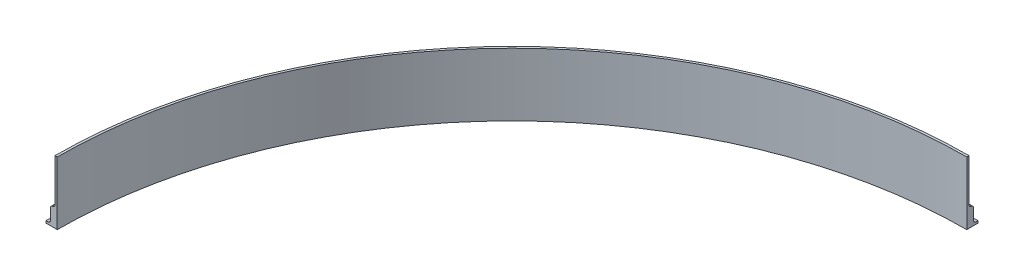
from build123d import *

# Parameters (mm, degrees)
BOTTOM_LEVEL_DEPTH = 5
MID_LEVEL_DEPTH    = 35
GUARD_RAIL_DEPTH   = 100
ROUNDING_R         = 5


with BuildPart() as part:
    # Sketch1 → Bottom level (new body)
    with BuildSketch(Plane(origin=(0, 0, 0), x_dir=(1, 0, 0), z_dir=(0, 1, 0))):
        with BuildLine():
            Line((0, 0), (25, 0))
            ThreePointArc((25, 0), (321.11504422, 714.88495578), (1036, 1011))
            Line((1036, 1011), (1036, 1036))
            ThreePointArc((1036, 1036), (303.437374691, 732.562625309), (0, 0))
        make_face()
    extrude(amount=BOTTOM_LEVEL_DEPTH)

    # Sketch2 → Mid level (add)
    with BuildSketch(Plane(origin=(0, 5, 0), x_dir=(1, 0, 0), z_dir=(0, 1, 0))):
        with BuildLine():
            Line((1036, 1011), (1036, 1026))
            ThreePointArc((1036, 1026), (310.508442503, 725.491557497), (10, 0))
            Line((10, 0), (25, 0))
            ThreePointArc((25, 0), (321.11504422, 714.88495578), (1036, 1011))
        make_face()
    extrude(amount=MID_LEVEL_DEPTH)

    # Sketch3 → Guard rail (add)
    with BuildSketch(Plane(origin=(0, 40, 0), x_dir=(1, 0, 0), z_dir=(0, 1, 0))):
        with BuildLine():
            Line((1036, 1016), (1036, 1011))
            ThreePointArc((1036, 1011), (321.11504422, 714.88495578), (25, 0))
            Line((25, 0), (20, 0))
            ThreePointArc((20, 0), (317.579510314, 718.420489686), (1036, 1016))
        make_face()
    extrude(amount=GUARD_RAIL_DEPTH)

    # Rounding
    rounding_edges = [part.edges().sort_by_distance(p)[0] for p in [
        (317.579510314, 40, -718.420489686),
        (310.508442503, 40, -725.491557497),
        (310.508442503, 5, -725.491557497),
    ]]
    fillet(rounding_edges, radius=ROUNDING_R - 0.0001)  # a hair under: the kernel refuses the full size


solid = part.part
